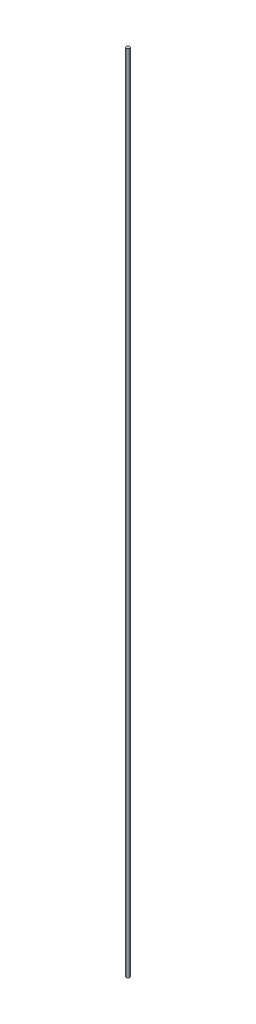
from build123d import *

# Parameters (mm, degrees)
SKETCH1_R           = 0.635
BOSS_EXTRUDE1_DEPTH = 304.8


with BuildPart() as part:
    # Sketch1 → Boss-Extrude1 (new body)
    with BuildSketch(Plane(origin=(0, 0, 0), x_dir=(1, 0, 0), z_dir=(0, 1, 0))):
        Circle(SKETCH1_R)
    extrude(amount=BOSS_EXTRUDE1_DEPTH)


solid = part.part
